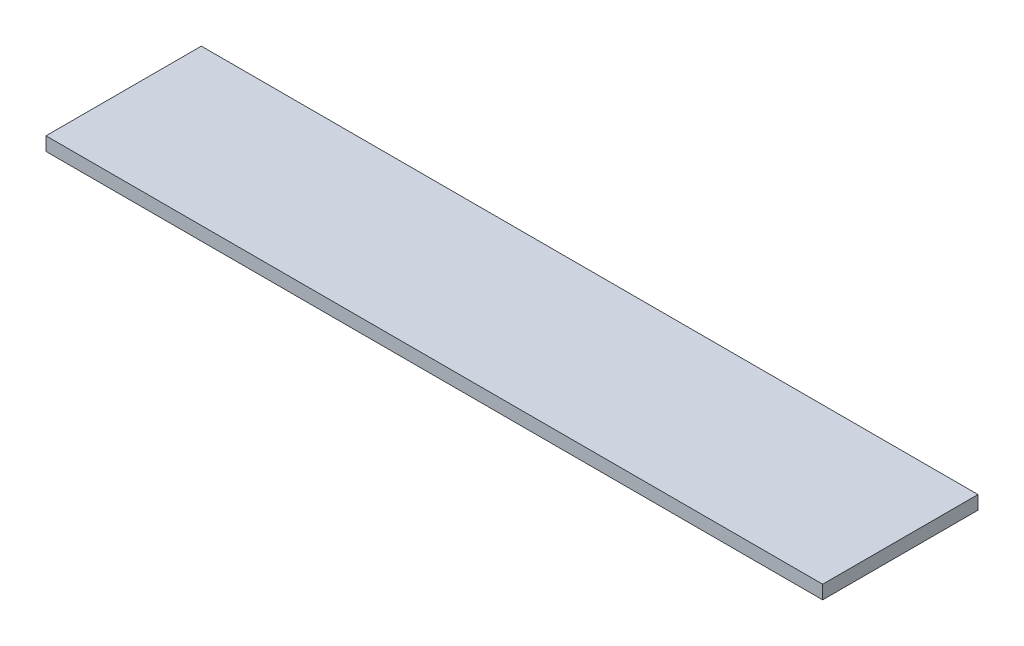
from build123d import *

# Parameters (mm, degrees)
SCHIZZO1_W                   = 400
SCHIZZO1_H                   = 80
ESTRUSIONE_ESTRUSIONE1_DEPTH = 7


with BuildPart() as part:
    # Schizzo1 → Estrusione-Estrusione1 (new body)
    with BuildSketch(Plane(origin=(0, 0, 0), x_dir=(1, 0, 0), z_dir=(0, 1, 0))):
        with Locations((200, 40)):
            Rectangle(SCHIZZO1_W, SCHIZZO1_H)
    extrude(amount=ESTRUSIONE_ESTRUSIONE1_DEPTH)


solid = part.part
